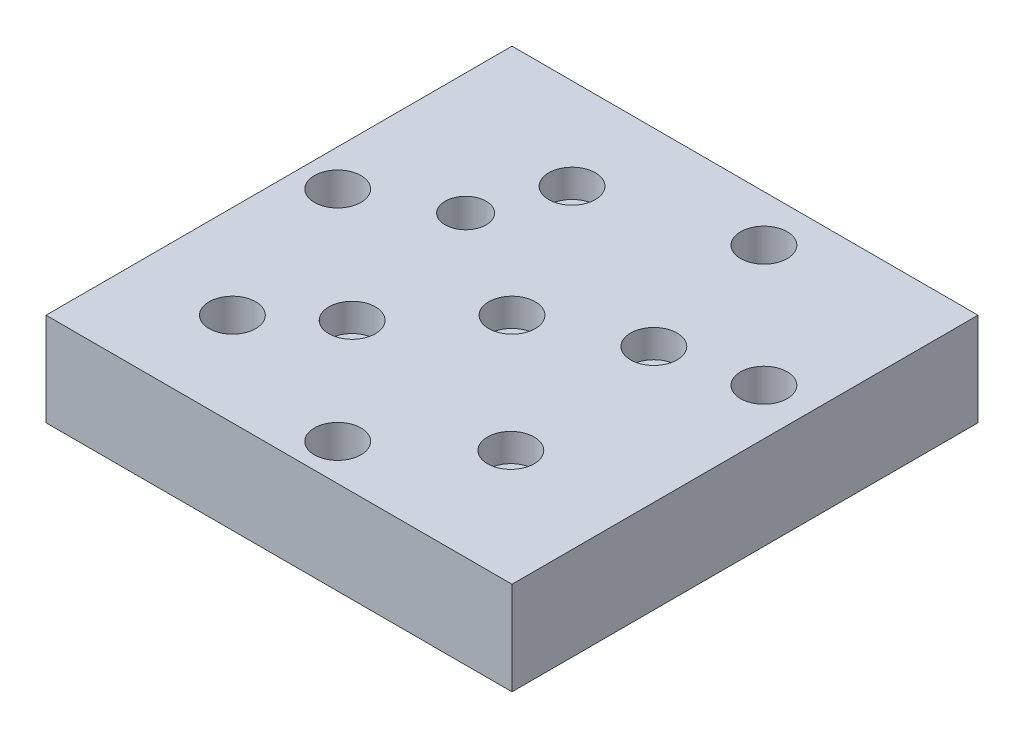
from build123d import *

# Parameters (mm, degrees)
SKETCH1_W                                           = 1270
SKETCH1_H                                           = 1270
SKETCH1_R                                           = 63.5
SKETCH1_R_2                                         = 55.942837161
BOSS_EXTRUDE1_DEPTH                                 = 254
CBORE_FOR_00_BINDING_HEAD_MACHINE_SCREW_D           = 76.2
CBORE_FOR_00_BINDING_HEAD_MACHINE_SCREW_CBORE_D     = 127
CBORE_FOR_00_BINDING_HEAD_MACHINE_SCREW_CBORE_DEPTH = 76.2


with BuildPart() as part:
    # Sketch1 → Boss-Extrude1 (new body)
    with BuildSketch(Plane(origin=(0, 0, 0), x_dir=(1, 0, 0), z_dir=(0, 1, 0))):
        Rectangle(SKETCH1_W, SKETCH1_H)
        with Locations((-381, -381)):
            Circle(SKETCH1_R, mode=Mode.SUBTRACT)
        with Locations((-535.427409328, 60.328180312)):
            Circle(SKETCH1_R, mode=Mode.SUBTRACT)
        with Locations((177.959434067, 508.578843275)):
            Circle(SKETCH1_R, mode=Mode.SUBTRACT)
        with Locations((508.578843275, 177.959434067)):
            Circle(SKETCH1_R, mode=Mode.SUBTRACT)
        with Locations((60.328180312, -535.427409328)):
            Circle(SKETCH1_R, mode=Mode.SUBTRACT)
        with Locations((-304.252781665, 177.959434067)):
            Circle(SKETCH1_R_2, mode=Mode.SUBTRACT)
    extrude(amount=BOSS_EXTRUDE1_DEPTH)

    # CBORE for #00 Binding Head Machine Screw1 (through all)
    with Locations(Plane(origin=(0, 254, 0), x_dir=(1, 0, 0), z_dir=(0, 1, 0))):
        with Locations((0, 0), (-205.835932946, -229.858685708), (-222.637167592, 386.279927999), (317.480625532, -320.666220822), (267.11009056, 119.500752341)):
            CounterBoreHole(CBORE_FOR_00_BINDING_HEAD_MACHINE_SCREW_D / 2, CBORE_FOR_00_BINDING_HEAD_MACHINE_SCREW_CBORE_D / 2, CBORE_FOR_00_BINDING_HEAD_MACHINE_SCREW_CBORE_DEPTH)


solid = part.part
